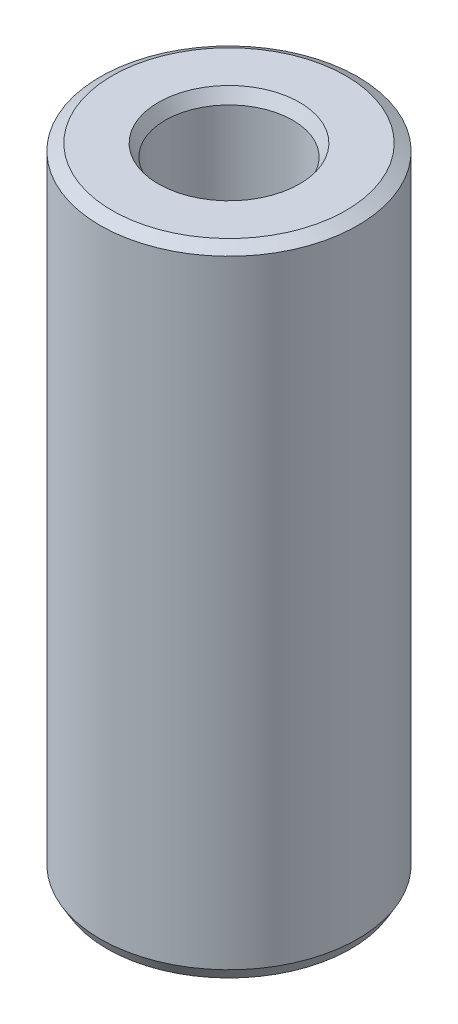
from build123d import *
from OCP.BRepFilletAPI import BRepFilletAPI_MakeChamfer

# Parameters (mm, degrees)
SKETCH1_R           = 27.5
BOSS_EXTRUDE1_DEPTH = 135.972632483
SKETCH2_R           = 13.611383157
CUT_EXTRUDE1_DEPTH  = 142.425092484
CHAMFER1_SIZE       = 1.477222887
CHAMFER1_SIZE2      = 2.558625094


with BuildPart() as part:
    # Sketch1 → Boss-Extrude1 (new body)
    with BuildSketch(Plane(origin=(0, 0, 0), x_dir=(1, 0, 0), z_dir=(0, 1, 0))):
        Circle(SKETCH1_R)
    extrude(amount=BOSS_EXTRUDE1_DEPTH)

    # Sketch2 → Cut-Extrude1 (cut, through all)
    with BuildSketch(Plane(origin=(0, 0, 0), x_dir=(1, 0, 0), z_dir=(0, 1, 0))):
        Circle(SKETCH2_R)
    extrude(amount=CUT_EXTRUDE1_DEPTH, mode=Mode.SUBTRACT)

    # Chamfer1: one chamfer whose edges measure the first distance from different faces: ONE call of the kernel's chamfer builder (chamfer() names one face for all edges)
    chamfer1_edges_1 = [part.edges().sort_by_distance(p)[0] for p in [
        (-13.611383157, 135.972632483, 0),
    ]]
    chamfer1_side_1 = [part.faces().sort_by_distance(p)[0] for p in [
        (-26.722182541, 135.972632483, 0),
    ]]
    chamfer1_edges_2 = [part.edges().sort_by_distance(p)[0] for p in [
        (-13.611383157, 0, 0),
    ]]
    chamfer1_side_2 = [part.faces().sort_by_distance(p)[0] for p in [
        (-13.611383157, 67.986316241, 0),
    ]]
    chamfer1_edges_3 = [part.edges().sort_by_distance(p)[0] for p in [
        (-27.5, 0, 0),
    ]]
    chamfer1_side_3 = [part.faces().sort_by_distance(p)[0] for p in [
        (-26.722182541, 0, 0),
    ]]
    chamfer1_edges_4 = [part.edges().sort_by_distance(p)[0] for p in [
        (-27.5, 135.972632483, 0),
    ]]
    chamfer1_side_4 = [part.faces().sort_by_distance(p)[0] for p in [
        (-27.5, 67.986316241, 0),
    ]]
    chamfer1 = BRepFilletAPI_MakeChamfer(part.part.solid().wrapped)
    for e in chamfer1_edges_1:
        chamfer1.Add(CHAMFER1_SIZE, CHAMFER1_SIZE2, e.wrapped, chamfer1_side_1[0].wrapped)  # the first distance lies on this face
    for e in chamfer1_edges_2:
        chamfer1.Add(CHAMFER1_SIZE, CHAMFER1_SIZE2, e.wrapped, chamfer1_side_2[0].wrapped)  # the first distance lies on this face
    for e in chamfer1_edges_3:
        chamfer1.Add(CHAMFER1_SIZE, CHAMFER1_SIZE2, e.wrapped, chamfer1_side_3[0].wrapped)  # the first distance lies on this face
    for e in chamfer1_edges_4:
        chamfer1.Add(CHAMFER1_SIZE, CHAMFER1_SIZE2, e.wrapped, chamfer1_side_4[0].wrapped)  # the first distance lies on this face
    add(Compound.cast(chamfer1.Shape()), mode=Mode.REPLACE)


solid = part.part
